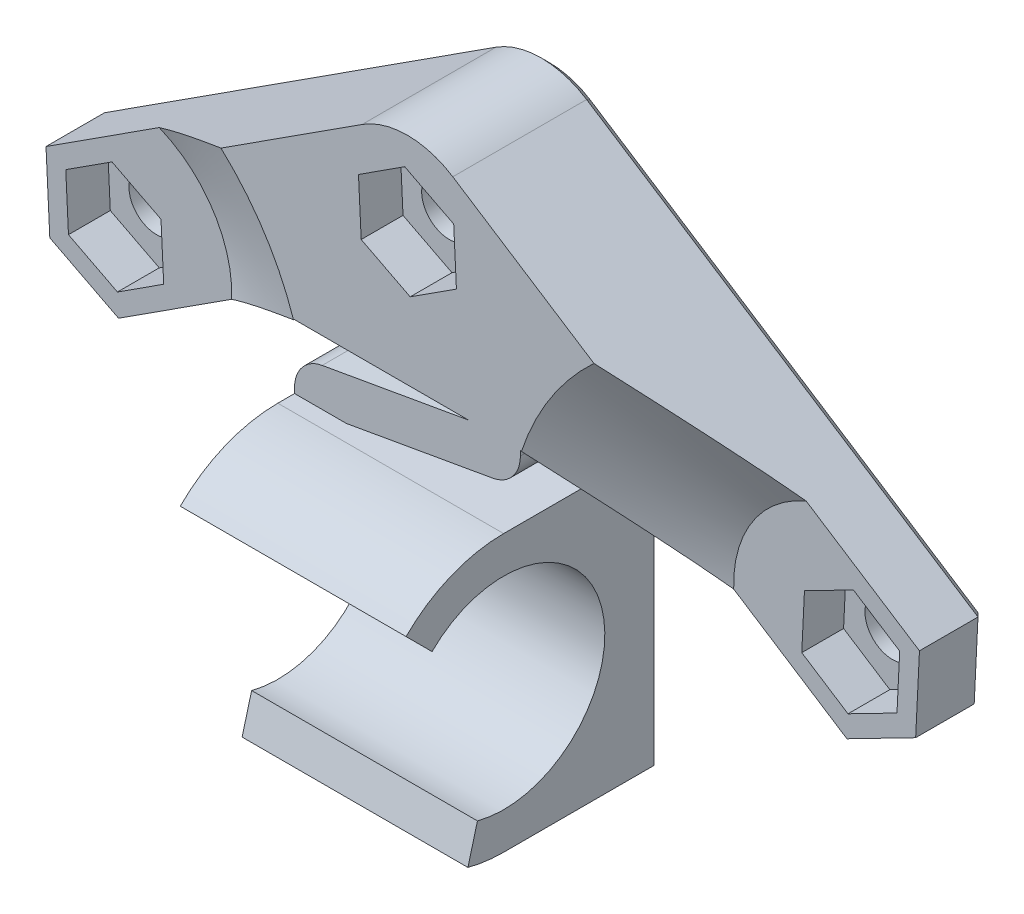
from build123d import *

# Parameters (mm, degrees)
BOSS_EXTRUDE1_DEPTH = 13.5
CUT_EXTRUDE1_DEPTH  = 19.454335534
SKETCH14_R          = 1.65
BOSS_EXTRUDE3_DEPTH = 8.5
CUT_EXTRUDE7_DEPTH  = 43.153930156
FILLET2_R           = 2
CUT_EXTRUDE9_DEPTH  = 4.5
CHAMFER2_SIZE       = 12
CHAMFER2_SIZE_2     = 6
CHAMFER3_SIZE       = 6
CHAMFER3_SIZE_2     = 12
CUT_EXTRUDE11_DEPTH = 2.5
CUT_EXTRUDE12_DEPTH = 2.5
CHAMFER4_SIZE       = 0.5
CHAMFER8_SIZE       = 0.5


with BuildPart() as part:
    # Sketch1 → Boss-Extrude1 (new body)
    with BuildSketch(Plane.ZY):
        with BuildLine():
            Line((-9.5, 8.25), (-9.5, -8.25))
            Line((-9.5, -8.25), (0, -8.25))
            ThreePointArc((0, -8.25), (8.25, 0), (0, 8.25))
            Line((0, 8.25), (-9.5, 8.25))
        make_face()
    extrude(amount=BOSS_EXTRUDE1_DEPTH)

    # Sketch7 → Cut-Extrude1 (cut, through all)
    with BuildSketch(Plane.ZY.offset(13.5)):
        with BuildLine():
            Line((13.481907846, 13.481907846), (4.277996026, 4.277996026))
            ThreePointArc((4.277996026, 4.277996026), (-5.843851249, 1.565855223), (1.565855223, -5.843851249))
            Line((1.565855223, -5.843851249), (4.934720763, -18.416628609))
            Line((4.934720763, -18.416628609), (13.481907846, 13.481907846))
        make_face()
    extrude(amount=-CUT_EXTRUDE1_DEPTH, mode=Mode.SUBTRACT)

    # Sketch14 → Boss-Extrude3 (add)
    with BuildSketch(Plane(origin=(0, 0, -9.5), x_dir=(-1, 0, 0), z_dir=(0, 0, -1))):
        with BuildLine():
            Line((4.039848555, 24.201794753), (-19.358847021, 9.109670469))
            Line((-19.358847021, 9.109670469), (-19.131451731, 4.496469334))
            Line((-19.131451731, 4.496469334), (-15.022604709, 2.386798865))
            Line((-15.022604709, 2.386798865), (0, 12.07635684))
            Line((0, 12.07635684), (0, 8.25))
            Line((0, 8.25), (13.5, 8.25))
            Line((13.5, 8.25), (13.5, 12.07635684))
            Line((13.5, 12.07635684), (28.522604709, 2.386798865))
            Line((28.522604709, 2.386798865), (32.631451731, 4.496469334))
            Line((32.631451731, 4.496469334), (32.858847021, 9.109670469))
            Line((32.858847021, 9.109670469), (9.460151445, 24.201794753))
            ThreePointArc((9.460151445, 24.201794753), (6.75, 25), (4.039848555, 24.201794753))
        make_face()
        with Locations((6.75, 20)):
            Circle(SKETCH14_R, mode=Mode.SUBTRACT)
        with Locations((-15.25, 7)):
            Circle(SKETCH14_R, mode=Mode.SUBTRACT)
        with Locations(Location((28.75, 7, 0), (0, 0, 180))):
            Circle(SKETCH14_R, mode=Mode.SUBTRACT)
    extrude(amount=-BOSS_EXTRUDE3_DEPTH)

    # Sketch15 → Cut-Extrude7 (cut, through all)
    with BuildSketch(Plane.XY.offset(-1)):
        Polygon((0, 8.25), (-10.401710887, 8.25), (0, 10.084102275), align=None)
        Polygon((-13.5, 10.242254565), (-13.5, 12.07635684), (-3.098289113, 12.07635684), align=None)
    extrude(amount=-CUT_EXTRUDE7_DEPTH, mode=Mode.SUBTRACT)

    # Fillet2
    fillet2_edges = [part.edges().sort_by_distance(p)[0] for p in [
        (0, 10.084102275, -5.25),
        (-13.5, 10.242254565, -5.25),
    ]]
    fillet(fillet2_edges, radius=FILLET2_R)

    # Sketch17 → Cut-Extrude9 (cut)
    with BuildSketch(Plane.XY.offset(-1)):
        with BuildLine():
            Line((19.131451731, 4.496469334), (19.358847021, 9.109670469))
            Line((19.358847021, 9.109670469), (17.418121156, 10.361435802))
            ThreePointArc((17.418121156, 10.361435802), (11.888564198, 9.168121156), (13.081878844, 3.638564198))
            Line((13.081878844, 3.638564198), (15.022604709, 2.386798865))
            Line((15.022604709, 2.386798865), (19.131451731, 4.496469334))
        make_face()
        with BuildLine():
            Line((-32.631451731, 4.496469334), (-28.522604709, 2.386798865))
            Line((-28.522604709, 2.386798865), (-26.581878844, 3.638564198))
            ThreePointArc((-26.581878844, 3.638564198), (-25.388564198, 9.168121156), (-30.918121156, 10.361435802))
            Line((-30.918121156, 10.361435802), (-32.858847021, 9.109670469))
            Line((-32.858847021, 9.109670469), (-32.631451731, 4.496469334))
        make_face()
    extrude(amount=-CUT_EXTRUDE9_DEPTH, mode=Mode.SUBTRACT)

    # Chamfer2
    # the kernel refuses this chamfer: 12, 6 mm, written as the material it takes off along each edge
    with BuildSketch(Plane(origin=(-28.75, 7, -1), x_dir=(-0.8386519680093931, -0.5446676753342096, 0), z_dir=(-0.5446676753342096, 0.8386519680093931, 0))) as chamfer2_piece_1_section:
        Polygon((4 + CHAMFER2_SIZE, 0), (4, -CHAMFER2_SIZE_2), (4, 0), align=None)
    chamfer2_piece_1 = revolve(axis=Axis((-28.75, 7, -1), (0, 0, 1)), revolution_arc=359.64, mode=Mode.PRIVATE)
    chamfer2_piece_1 = split(chamfer2_piece_1, bisect_by=Plane(origin=(-26.581878844, 3.638564198, -1), z_dir=(-0.5420302889814643, 0.8403589505840171, 0)), keep=Keep.TOP, mode=Mode.PRIVATE)
    chamfer2_piece_1 = split(chamfer2_piece_1, bisect_by=Plane(origin=(-28.75, 7, -5.5), z_dir=(0, 0, 1)), keep=Keep.TOP, mode=Mode.PRIVATE)
    add(chamfer2_piece_1, mode=Mode.SUBTRACT)

    # Chamfer3
    # the kernel refuses this chamfer: 12, 6 mm, written as the material it takes off along each edge
    with BuildSketch(Plane(origin=(15.25, 7, -1), x_dir=(0.8420576391550663, -0.5393875530085916, 0), z_dir=(-0.5393875530085916, -0.8420576391550663, 0))) as chamfer3_piece_1_section:
        Polygon((4, -CHAMFER3_SIZE), (4 + CHAMFER3_SIZE_2, 0), (4, 0), align=None)
    chamfer3_piece_1 = revolve(axis=Axis((15.25, 7, -1), (0, 0, 1)), revolution_arc=359.64, mode=Mode.PRIVATE)
    chamfer3_piece_1 = split(chamfer3_piece_1, bisect_by=Plane(origin=(15.25, 7, -5.5), z_dir=(0, 0, 1)), keep=Keep.TOP, mode=Mode.PRIVATE)
    chamfer3_piece_1 = split(chamfer3_piece_1, bisect_by=Plane(origin=(0, 7, -1), z_dir=(1, 0, 0)), keep=Keep.TOP, mode=Mode.PRIVATE)
    add(chamfer3_piece_1, mode=Mode.SUBTRACT)

    # Sketch19 → Cut-Extrude11 (cut)
    with BuildSketch(Plane.XY.offset(-5.5)):
        Polygon((-31.515534358, 5.2162344), (-28.587980855, 3.713094191), (-25.822446497, 5.496859791), (-25.984465642, 8.7837656), (-28.912019145, 10.286905809), (-31.677553503, 8.503140209), align=None)
        Polygon((18.015534358, 5.2162344), (18.177553503, 8.503140209), (15.412019145, 10.286905809), (12.484465642, 8.7837656), (12.322446497, 5.496859791), (15.087980855, 3.713094191), align=None)
    extrude(amount=-CUT_EXTRUDE11_DEPTH, mode=Mode.SUBTRACT)

    # Sketch20 → Cut-Extrude12 (cut)
    with BuildSketch(Plane.XY.offset(-1)):
        Polygon((-9.515534358, 18.2162344), (-6.587980855, 16.713094191), (-3.822446497, 18.496859791), (-3.984465642, 21.7837656), (-6.912019145, 23.286905809), (-9.677553503, 21.503140209), align=None)
    extrude(amount=-CUT_EXTRUDE12_DEPTH, mode=Mode.SUBTRACT)

    # Chamfer4
    chamfer4_edges = [part.edges().sort_by_distance(p)[0] for p in [
        (-5.1, 20, -9.5),
        (16.9, 7, -9.5),
        (-30.4, 7, -9.5),
    ]]
    chamfer(chamfer4_edges, length=CHAMFER4_SIZE)

    # Chamfer8
    # the kernel refuses this chamfer: 0.5 mm, written as the material it takes off along each edge
    with BuildSketch(Plane(origin=(-13.5, 10.749985843, -9.5), x_dir=(1, 0, 0), z_dir=(0, -1, 0))) as chamfer8_piece_1:
        Polygon((CHAMFER8_SIZE, 0), (0, CHAMFER8_SIZE), (0, 0), align=None)
    extrude(amount=20.285827337, mode=Mode.SUBTRACT)
    with BuildSketch(Plane(origin=(-12.419431591, 12.773321877, -9.5), x_dir=(-0.5420302889814643, 0.8403589505840171, 0), z_dir=(-0.8403589505840171, -0.5420302889814643, 0))) as chamfer8_piece_2_section:
        Polygon((CHAMFER8_SIZE, 0), (0, -CHAMFER8_SIZE), (0, 0), align=None)
    chamfer8_piece_2 = extrude(amount=20.448097226, mode=Mode.PRIVATE)
    chamfer8_piece_2 = split(chamfer8_piece_2, bisect_by=Plane(origin=(-12.419431591, 12.07635684, -9.5), z_dir=(0, -1, 0)), keep=Keep.TOP, mode=Mode.PRIVATE)
    add(chamfer8_piece_2, mode=Mode.SUBTRACT)
    with BuildSketch(Plane(origin=(-27.378731078, 1.799481691, -9.5), x_dir=(0.4567570550126589, 0.8895914751705769, 0), z_dir=(-0.8895914751705769, 0.4567570550126589, 0)), Plane(origin=(-32.568146508, 3.212187123, -9.5), x_dir=(0.9987873439941226, 0.04923252458656117, 0), z_dir=(-0.04923252458656117, 0.9987873439941226, 0)), Plane(origin=(19.422152244, 10.39395268, -9.5), x_dir=(-0.9987873439941226, 0.049232524586561265, 0), z_dir=(-0.049232524586561265, -0.9987873439941226, 0)), Plane(origin=(20.275325362, 5.083786508, -9.5), x_dir=(-0.4567570550126585, 0.8895914751705769, 0), z_dir=(-0.889591475170577, -0.45675705501265856, 0))) as chamfer8_piece_3:
        Polygon((CHAMFER8_SIZE, 0), (0, -CHAMFER8_SIZE), (0, 0), align=None)
    extrude(amount=7.190485141, mode=Mode.SUBTRACT)
    with BuildSketch(Plane(origin=(-33.93941543, 8.412705433, -9.5), x_dir=(0.5420302889814647, -0.8403589505840169, 0), z_dir=(0.8403589505840168, 0.5420302889814647, 0)), Plane(origin=(-4.039848555, 24.201794753, -9.5), x_dir=(-0.5420302889814645, -0.840358950584017, 0), z_dir=(0.8403589505840169, -0.5420302889814645, 0))) as chamfer8_piece_4:
        Polygon((CHAMFER8_SIZE, 0), (0, -CHAMFER8_SIZE), (0, 0), align=None)
    extrude(amount=29.12953324, mode=Mode.SUBTRACT)
    with BuildSketch(Plane(origin=(-6.75, 20, -9.5), x_dir=(-0.5420302889814639, 0.8403589505840172, 0), z_dir=(-0.8403589505840172, -0.5420302889814639, 0))) as chamfer8_piece_5:
        Polygon((5 - CHAMFER8_SIZE, 0), (5, -CHAMFER8_SIZE), (5, 0), align=None)
    revolve(axis=Axis((-6.75, 20, -9.5), (0, 0, -1)), revolution_arc=65.643913307, mode=Mode.SUBTRACT)
    with BuildSketch(Plane(origin=(16.103173118, 1.689833828, -9.5), x_dir=(0.5420302889814647, 0.8403589505840168, 0), z_dir=(-0.8403589505840168, 0.5420302889814647, 0))) as chamfer8_piece_6_section:
        Polygon((CHAMFER8_SIZE, 0), (0, -CHAMFER8_SIZE), (0, 0), align=None)
    chamfer8_piece_6 = extrude(amount=20.448097226, mode=Mode.PRIVATE)
    chamfer8_piece_6 = split(chamfer8_piece_6, bisect_by=Plane(origin=(0, 1.689833828, -9.5), z_dir=(1, 0, 0)), keep=Keep.TOP, mode=Mode.PRIVATE)
    add(chamfer8_piece_6, mode=Mode.SUBTRACT)
    with BuildSketch(Plane(origin=(0, -9.535841494, -9.5), x_dir=(-1, 0, 0), z_dir=(0, 1, 0))) as chamfer8_piece_7:
        Polygon((CHAMFER8_SIZE, 0), (0, CHAMFER8_SIZE), (0, 0), align=None)
    extrude(amount=19.071682988, mode=Mode.SUBTRACT)
    with BuildSketch(Plane(origin=(1.285841494, -8.25, -9.5), x_dir=(0, 1, 0), z_dir=(-1, 0, 0))) as chamfer8_piece_8:
        Polygon((CHAMFER8_SIZE, 0), (0, -CHAMFER8_SIZE), (0, 0), align=None)
    extrude(amount=16.071682988, mode=Mode.SUBTRACT)


solid = part.part
